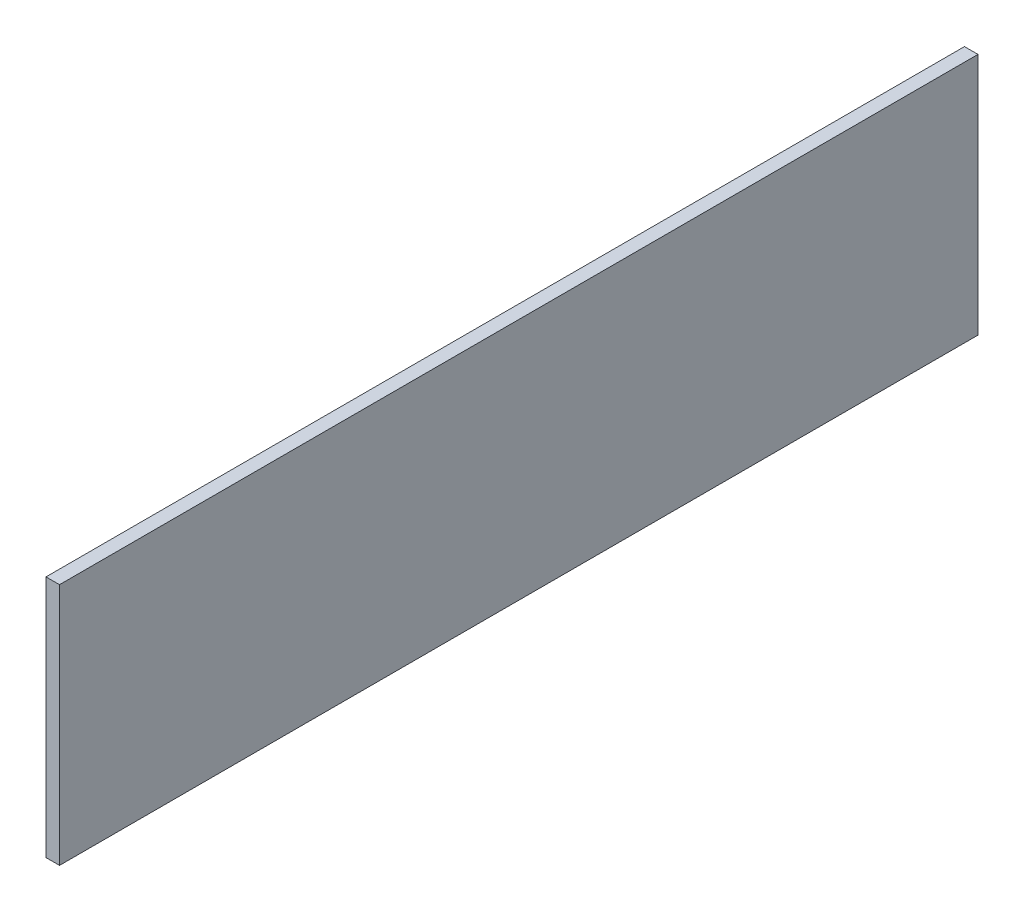
from build123d import *

# Parameters (mm, degrees)
SKETCH1_W           = 107.95
SKETCH1_H           = 28.575
BOSS_EXTRUDE1_DEPTH = 1.5875


with BuildPart() as part:
    # Sketch1 → Boss-Extrude1 (new body)
    with BuildSketch(Plane(origin=(0, 0, 0), x_dir=(0, 0, -1), z_dir=(1, 0, 0))):
        Rectangle(SKETCH1_W, SKETCH1_H)
    extrude(amount=BOSS_EXTRUDE1_DEPTH)


solid = part.part
